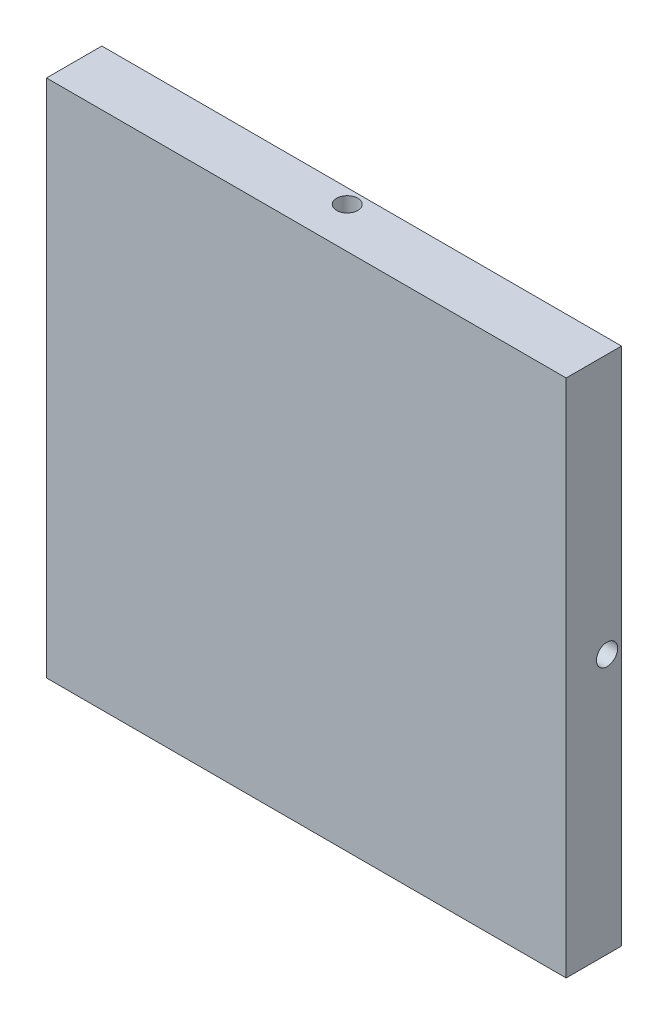
from build123d import *

# Parameters (mm, degrees)
SKETCH1_W           = 171.45
SKETCH1_H           = 171.45
BOSS_EXTRUDE1_DEPTH = 8.73125
SKETCH1_3_W         = 171.45
SKETCH1_3_H         = 171.45
SKETCH1_3_R         = 3.175
SKETCH1_3_R_2       = 76.99375
BOSS_EXTRUDE2_DEPTH = 9.525
SKETCH1_4_R         = 3.175
BOSS_EXTRUDE3_DEPTH = 18.3515
CUT_EXTRUDE1_REACH  = 194.563
SKETCH2_R           = 3.5
CIRPATTERN1_COUNT   = 4
CUT_EXTRUDE2_DEPTH  = 5.08
FILLET3_R           = 3.175


with BuildPart() as part:
    # Sketch1 → Boss-Extrude1 (new body)
    with BuildSketch(Plane.XY):
        Rectangle(SKETCH1_W, SKETCH1_H)
    extrude(amount=BOSS_EXTRUDE1_DEPTH)

    # Sketch1<3> → Boss-Extrude2 (add)
    # profile 1 of 5: a face of its own
    with BuildSketch(Plane.XY):
        Rectangle(SKETCH1_3_W, SKETCH1_3_H)
        with Locations((-73.025, -73.025)):
            Circle(SKETCH1_3_R, mode=Mode.SUBTRACT)
        with Locations((73.025, -73.025)):
            Circle(SKETCH1_3_R, mode=Mode.SUBTRACT)
        with Locations((-73.025, 73.025)):
            Circle(SKETCH1_3_R, mode=Mode.SUBTRACT)
        Circle(SKETCH1_3_R_2, mode=Mode.SUBTRACT)
        with Locations((73.025, 73.025)):
            Circle(SKETCH1_3_R, mode=Mode.SUBTRACT)
    # profile 2 of 5: a face of its own
    with BuildSketch(Plane.XY):
        with Locations((-19.546451191, -53.703433278)):
            Circle(SKETCH1_3_R)
    # profile 3 of 5: a face of its own
    with BuildSketch(Plane.XY):
        Circle(SKETCH1_3_R)
    # profile 4 of 5: a face of its own
    with BuildSketch(Plane.XY):
        with Locations((-36.735311894, 43.779439924)):
            Circle(SKETCH1_3_R)
    # profile 5 of 5: a face of its own
    with BuildSketch(Plane.XY):
        with Locations((56.281763085, 9.923993354)):
            Circle(SKETCH1_3_R)
    extrude(amount=-BOSS_EXTRUDE2_DEPTH)

    # Sketch1<4> → Boss-Extrude3 (add)
    with BuildSketch(Plane.XY):
        Circle(SKETCH1_4_R)
    extrude(amount=-BOSS_EXTRUDE3_DEPTH)

    # Sketch2 → Cut-Extrude1 (cut, up to next)
    with BuildSketch(Plane(origin=(0, 85.725, 0), x_dir=(1, 0, 0), z_dir=(0, 1, 0)), mode=Mode.PRIVATE) as cut_extrude1_sk1:
        with Locations((0, 4.7625)):
            Circle(SKETCH2_R)
    cut_extrude1_tool1 = extrude(cut_extrude1_sk1.sketch, amount=-CUT_EXTRUDE1_REACH, mode=Mode.PRIVATE) & part.part
    cut_extrude1 = cut_extrude1_tool1.solids().sort_by_distance((0, 85.725, -4.7625))[0]
    add(cut_extrude1, mode=Mode.SUBTRACT)

    # CirPattern1: Cut-Extrude1 ×4 about axis
    cirpattern1_axis = Axis((0, 0, -9.525), (0, 0, 1))
    for i in range(1, CIRPATTERN1_COUNT):
        add(cut_extrude1.rotate(cirpattern1_axis, i * 360 / CIRPATTERN1_COUNT), mode=Mode.SUBTRACT)

    # Sketch4 → Cut-Extrude2 (cut)
    with BuildSketch(Plane(origin=(0, 0, 0), x_dir=(-1, 0, 0), z_dir=(0, 0, -1))):
        with BuildLine():
            Line((-67.235953889, 1.5875), (-36.973195778, 1.5875))
            ThreePointArc((-36.973195778, 1.5875), (-35.385695778, 0), (-36.973195778, -1.5875))
            Line((-36.973195778, -1.5875), (-67.235953889, -1.5875))
            ThreePointArc((-67.235953889, -1.5875), (-68.823453889, 0), (-67.235953889, 1.5875))
        make_face()
    extrude(amount=-CUT_EXTRUDE2_DEPTH, mode=Mode.SUBTRACT)

    # Fillet3
    fillet3_edges = [part.edges().sort_by_distance(p)[0] for p in [
        (52.104574834, 1.5875, 0),
        (35.385695778, 0, 0),
        (52.104574834, -1.5875, 0),
        (68.823453889, 0, 0),
    ]]
    fillet(fillet3_edges, radius=FILLET3_R)


solid = part.part
